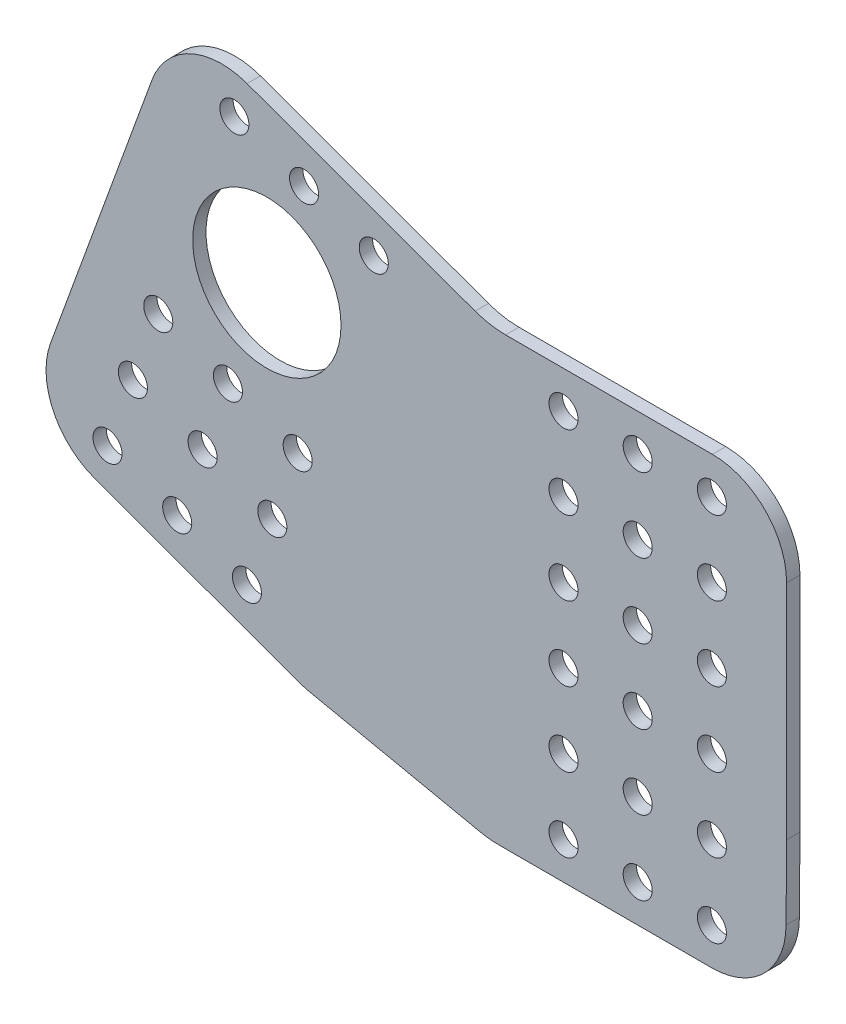
from build123d import *

# Parameters (mm, degrees)
SKETCH2_R           = 2.4892
SKETCH2_R_2         = 12.7
BOSS_EXTRUDE1_DEPTH = 2.286
FILLET6_R           = 12.7
FILLET7_R           = 15.24


with BuildPart() as part:
    # Sketch2 → Boss-Extrude1 (new body)
    with BuildSketch(Plane.XY):
        Polygon((33.430156219, 560.153270419), (33.430156219, 610.953270419), (-17.369843781, 610.953270419), (-70.882869838, 630.430419049), (-92.601148921, 570.759937623), (-96.944804742, 558.825841339), (-49.208419606, 541.451218058), (-17.464279743, 534.753270419), (33.335720257, 534.753270419), (33.335720257, 547.453270419), align=None)
        with Locations((-4.764279743, 566.503270419)):
            Circle(SKETCH2_R, mode=Mode.SUBTRACT)
        with Locations((-4.764279743, 579.203270419)):
            Circle(SKETCH2_R, mode=Mode.SUBTRACT)
        with Locations((7.935720257, 566.503270419)):
            Circle(SKETCH2_R, mode=Mode.SUBTRACT)
        with Locations((20.635720257, 566.503270419)):
            Circle(SKETCH2_R, mode=Mode.SUBTRACT)
        with Locations((7.935720257, 579.203270419)):
            Circle(SKETCH2_R, mode=Mode.SUBTRACT)
        with Locations((20.635720257, 579.203270419)):
            Circle(SKETCH2_R, mode=Mode.SUBTRACT)
        with Locations((-4.764279743, 591.903270419)):
            Circle(SKETCH2_R, mode=Mode.SUBTRACT)
        with Locations((-4.764279743, 604.603270419)):
            Circle(SKETCH2_R, mode=Mode.SUBTRACT)
        with Locations((7.935720257, 591.903270419)):
            Circle(SKETCH2_R, mode=Mode.SUBTRACT)
        with Locations((20.635720257, 591.903270419)):
            Circle(SKETCH2_R, mode=Mode.SUBTRACT)
        with Locations((7.935720257, 604.603270419)):
            Circle(SKETCH2_R, mode=Mode.SUBTRACT)
        with Locations((20.635720257, 604.603270419)):
            Circle(SKETCH2_R, mode=Mode.SUBTRACT)
        with Locations((20.635720257, 553.803270419)):
            Circle(SKETCH2_R, mode=Mode.SUBTRACT)
        with Locations((-4.764279743, 553.803270419)):
            Circle(SKETCH2_R, mode=Mode.SUBTRACT)
        with Locations((7.935720257, 553.803270419)):
            Circle(SKETCH2_R, mode=Mode.SUBTRACT)
        with Locations((20.635720257, 541.103270419)):
            Circle(SKETCH2_R, mode=Mode.SUBTRACT)
        with Locations((7.935720257, 541.103270419)):
            Circle(SKETCH2_R, mode=Mode.SUBTRACT)
        with Locations((-4.764279743, 541.103270419)):
            Circle(SKETCH2_R, mode=Mode.SUBTRACT)
        with Locations((-37.25240889, 611.432403444)):
            Circle(SKETCH2_R, mode=Mode.SUBTRACT)
        with Locations((-50.283376351, 575.630114592)):
            Circle(SKETCH2_R, mode=Mode.SUBTRACT)
        with Locations((-62.217472635, 579.973770413)):
            Circle(SKETCH2_R, mode=Mode.SUBTRACT)
        with Locations((-74.151568919, 584.317426233)):
            Circle(SKETCH2_R, mode=Mode.SUBTRACT)
        with Locations((-55.562991918, 598.25680592)):
            Circle(SKETCH2_R_2, mode=Mode.SUBTRACT)
        with Locations((-61.120601458, 620.119715085)):
            Circle(SKETCH2_R, mode=Mode.SUBTRACT)
        with Locations((-49.186505174, 615.776059265)):
            Circle(SKETCH2_R, mode=Mode.SUBTRACT)
        with Locations((-78.495224739, 572.383329949)):
            Circle(SKETCH2_R, mode=Mode.SUBTRACT)
        with Locations((-54.627032171, 563.696018308)):
            Circle(SKETCH2_R, mode=Mode.SUBTRACT)
        with Locations((-66.561128455, 568.039674129)):
            Circle(SKETCH2_R, mode=Mode.SUBTRACT)
        with Locations((-58.970687991, 551.761922025)):
            Circle(SKETCH2_R, mode=Mode.SUBTRACT)
        with Locations((-82.838880559, 560.449233665)):
            Circle(SKETCH2_R, mode=Mode.SUBTRACT)
        with Locations((-70.904784275, 556.105577845)):
            Circle(SKETCH2_R, mode=Mode.SUBTRACT)
    extrude(amount=BOSS_EXTRUDE1_DEPTH)

    # Fillet6
    fillet6_edges = [part.edges().sort_by_distance(p)[0] for p in [
        (-70.882869838, 630.430419049, 1.143),
        (-96.944804742, 558.825841339, 1.143),
        (33.430156219, 610.953270419, 1.143),
        (33.335720257, 534.753270419, 1.143),
    ]]
    fillet(fillet6_edges, radius=FILLET6_R - 0.0001)  # a hair under: the kernel refuses the full size

    # Fillet7
    fillet7_edges = [part.edges().sort_by_distance(p)[0] for p in [
        (-17.464279743, 534.753270419, 1.143),
        (-49.208419606, 541.451218058, 1.143),
        (-17.369843781, 610.953270419, 1.143),
    ]]
    fillet(fillet7_edges, radius=FILLET7_R)


solid = part.part
